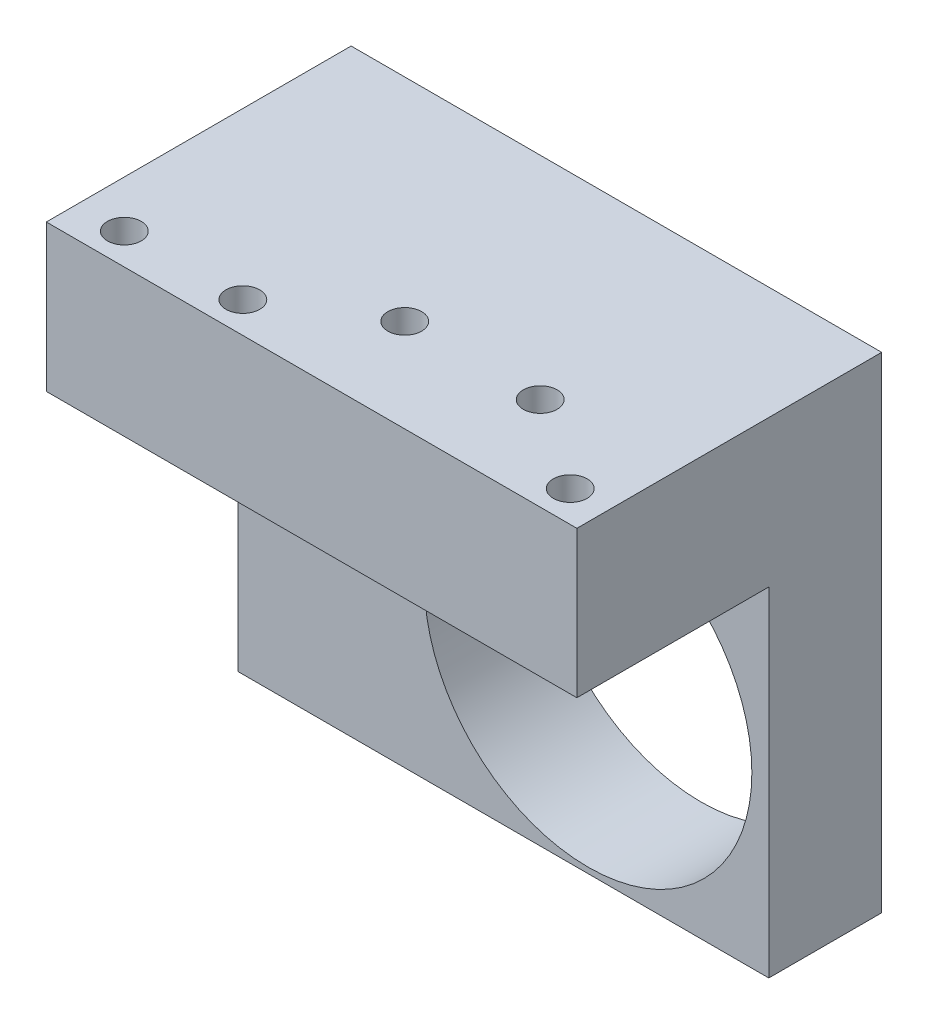
from build123d import *

# Parameters (mm, degrees)
SKETCH_1_R      = 1.5
EXTRUDE_1_DEPTH = 13
SKETCH_3_W      = 47
SKETCH_3_H      = 30
SKETCH_3_R      = 14.5
EXTRUDE_2_DEPTH = 10


with BuildPart() as part:
    # 草图1 → 凸台-拉伸1 (new body)
    with BuildSketch(Plane(origin=(0, 0, 0), x_dir=(1, 0, 0), z_dir=(0, 1, 0))):
        Polygon((-23.5, 5.5), (-23.5, 21.5), (23.5, 21.5), (23.5, 5.5), (23.5, -5.5), (-23.5, -5.5), align=None)
        with Locations((-19.340757383, -2.75)):
            Circle(SKETCH_1_R, mode=Mode.SUBTRACT)
        with Locations((-8.840757383, -2.75)):
            Circle(SKETCH_1_R, mode=Mode.SUBTRACT)
        with Locations((20.159242617, -2.75)):
            Circle(SKETCH_1_R, mode=Mode.SUBTRACT)
        with Locations((0, 2.75)):
            Circle(SKETCH_1_R, mode=Mode.SUBTRACT)
        with Locations((12, 2.75)):
            Circle(SKETCH_1_R, mode=Mode.SUBTRACT)
    extrude(amount=EXTRUDE_1_DEPTH)

    # 草图3 → 凸台-拉伸2 (add)
    with BuildSketch(Plane(origin=(0, 0, -21.5), x_dir=(-1, 0, 0), z_dir=(0, 0, -1))):
        with Locations((0, -15)):
            Rectangle(SKETCH_3_W, SKETCH_3_H)
        with Locations((-7.5, -15)):
            Circle(SKETCH_3_R, mode=Mode.SUBTRACT)
    extrude(amount=-EXTRUDE_2_DEPTH)


solid = part.part
